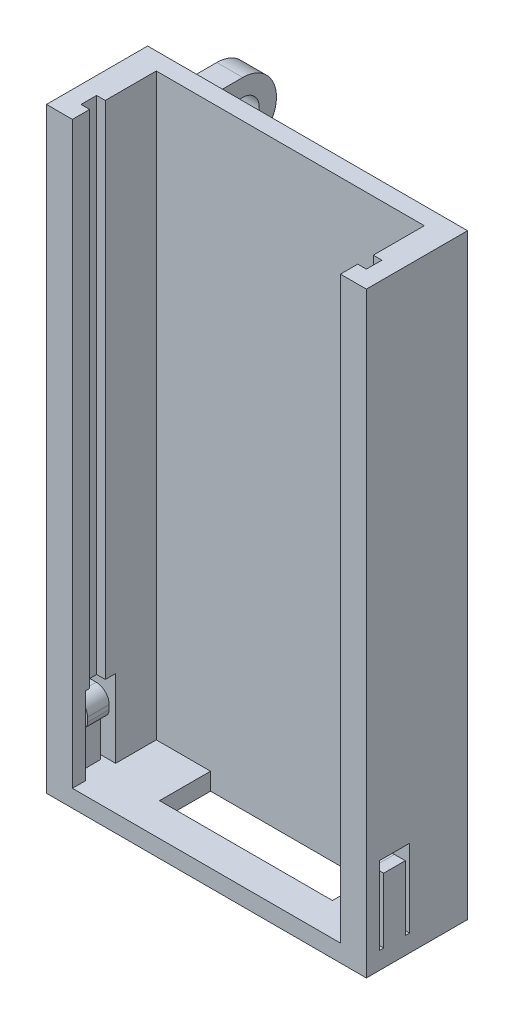
from build123d import *

# Parameters (mm, degrees)
SKETCH1_W           = 37
SKETCH1_H           = 11.7
BOSS_EXTRUDE1_DEPTH = 69
CUT_EXTRUDE1_DEPTH  = 67
SKETCH3_W           = 20
SKETCH3_H           = 5.9
CUT_EXTRUDE2_DEPTH  = 67
BOSS_EXTRUDE2_START = -34
SKETCH4_R           = 1.9
BOSS_EXTRUDE2_DEPTH = 3
FILLET1_R           = 2
SKETCH5_W           = 3.5
SKETCH5_H           = 9
CUT_EXTRUDE3_DEPTH  = 40
BOSS_EXTRUDE3_START = 0.5
BOSS_EXTRUDE3_DEPTH = 2.5


with BuildPart() as part:
    # Sketch1 → Boss-Extrude1 (new body)
    with BuildSketch(Plane(origin=(0, 0, 0), x_dir=(1, 0, 0), z_dir=(0, 1, 0))):
        with Locations((18.5, 5.85)):
            Rectangle(SKETCH1_W, SKETCH1_H)
    extrude(amount=BOSS_EXTRUDE1_DEPTH)

    # Sketch2 → Cut-Extrude1 (cut)
    with BuildSketch(Plane(origin=(0, 69, 0), x_dir=(1, 0, 0), z_dir=(0, 1, 0))):
        Polygon((3, 0), (3, 2), (2, 2), (2, 3.8), (3, 3.8), (3, 9.7), (34, 9.7), (34, 3.8), (35, 3.8), (35, 2), (34, 2), (34, 0), align=None)
    extrude(amount=-CUT_EXTRUDE1_DEPTH, mode=Mode.SUBTRACT)

    # Sketch3 → Cut-Extrude2 (cut)
    with BuildSketch(Plane(origin=(0, 2, 0), x_dir=(1, 0, 0), z_dir=(0, 1, 0))):
        with Locations((19.275, 6.75)):
            Rectangle(SKETCH3_W, SKETCH3_H)
    extrude(amount=-CUT_EXTRUDE2_DEPTH, mode=Mode.SUBTRACT)

    # Sketch4 → Boss-Extrude2 (add)
    # profile 1 of 2: a face of its own
    with BuildSketch(Plane(origin=(37, 0, 0), x_dir=(0, 0, -1), z_dir=(1, 0, 0)).offset(BOSS_EXTRUDE2_START)):
        with BuildLine():
            Line((11.7, 63.35), (19.7, 63.35))
            ThreePointArc((19.7, 63.35), (23.6, 59.45), (19.7, 55.55))
            Line((19.7, 55.55), (11.7, 55.55))
            Line((11.7, 55.55), (11.7, 63.35))
        make_face()
        with Locations((19.7, 59.45)):
            Circle(SKETCH4_R, mode=Mode.SUBTRACT)
    # profile 2 of 2: a face of its own
    with BuildSketch(Plane(origin=(37, 0, 0), x_dir=(0, 0, -1), z_dir=(1, 0, 0)).offset(BOSS_EXTRUDE2_START)):
        with BuildLine():
            Line((11.7, 27.35), (19.7, 27.35))
            ThreePointArc((19.7, 27.35), (23.6, 23.45), (19.7, 19.55))
            Line((19.7, 19.55), (11.7, 19.55))
            Line((11.7, 19.55), (11.7, 27.35))
        make_face()
        with Locations((19.7, 23.45)):
            Circle(SKETCH4_R, mode=Mode.SUBTRACT)
    extrude(amount=-BOSS_EXTRUDE2_DEPTH)

    # Fillet1
    fillet1_edges = [part.edges().sort_by_distance(p)[0] for p in [
        (1.5, 19.55, -11.7),
        (1.5, 27.35, -11.7),
        (1.5, 55.55, -11.7),
        (1.5, 63.35, -11.7),
        (3, 23.45, -11.7),
        (3, 59.45, -11.7),
    ]]
    fillet(fillet1_edges, radius=FILLET1_R)

    # Sketch5 → Cut-Extrude3 (cut)
    with BuildSketch(Plane(origin=(37, 0, 0), x_dir=(0, 0, -1), z_dir=(1, 0, 0))):
        with Locations((3.25, 6.5)):
            Rectangle(SKETCH5_W, SKETCH5_H)
    extrude(amount=-CUT_EXTRUDE3_DEPTH, mode=Mode.SUBTRACT)

    # Sketch6 → Boss-Extrude3 (add)
    with BuildSketch(Plane.XY.offset(-5).offset(BOSS_EXTRUDE3_START)):
        with BuildLine():
            Line((37, 2), (37, 9.5))
            Line((37, 9.5), (35.75, 9.5))
            ThreePointArc((35.75, 9.5), (34.689339828, 9.060660172), (34.25, 8))
            Line((34.25, 8), (34.25, 7.5))
            ThreePointArc((34.25, 7.5), (34.542893219, 6.792893219), (35.25, 6.5))
            Line((35.25, 6.5), (35.25, 2))
            Line((35.25, 2), (37, 2))
        make_face()
    boss_extrude3 = extrude(amount=BOSS_EXTRUDE3_DEPTH)

    # Mirror1: Boss-Extrude3 across plane
    add(boss_extrude3.mirror(Plane(origin=(18.5, 0, 0), x_dir=(0, 0, 1), z_dir=(1, 0, 0))))


solid = part.part
